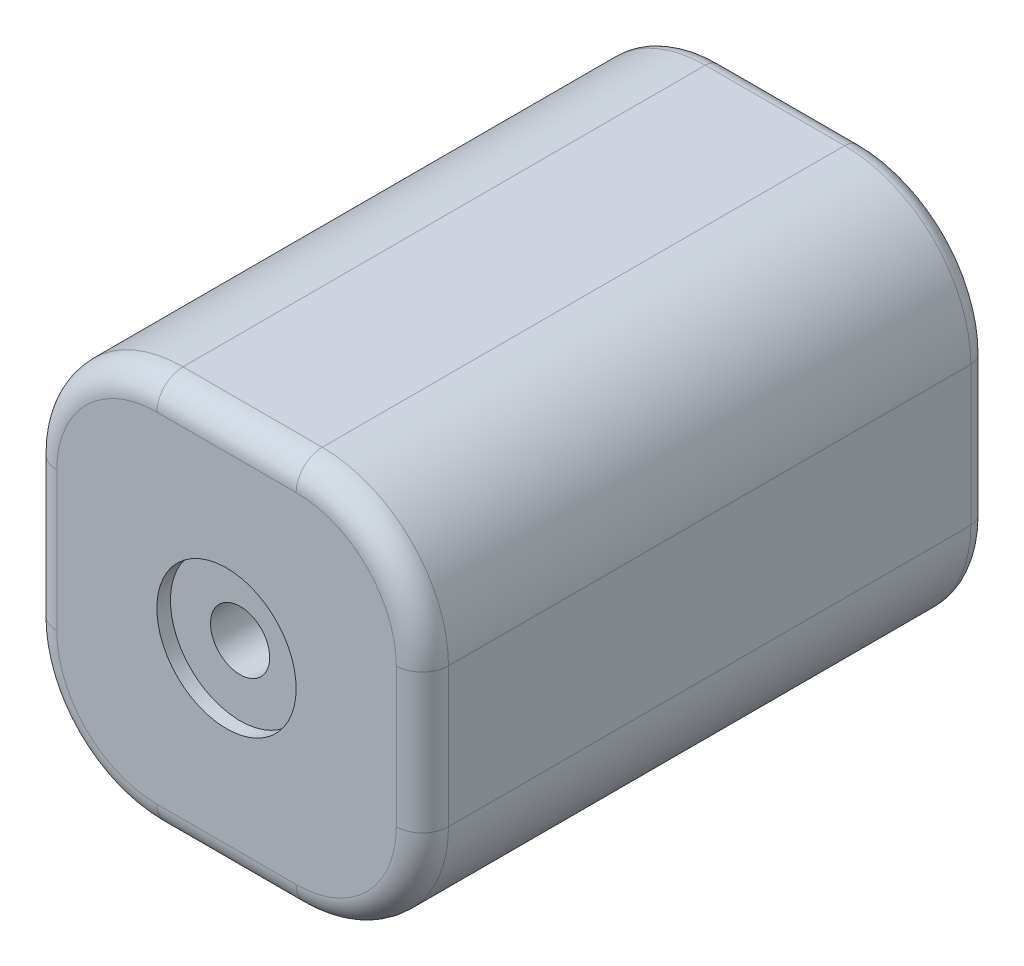
from build123d import *

# Parameters (mm, degrees)
BOSS_EXTRUDE1_DEPTH = 65
FILLET1_R           = 2
BOSS_EXTRUDE2_START = -10
BOSS_EXTRUDE2_DEPTH = 10
SKETCH3_R           = 3.4
CUT_EXTRUDE1_DEPTH  = 73.370574131
FILLET2_R           = 3
SKETCH4_R           = 8
CUT_EXTRUDE2_DEPTH  = 1.56


with BuildPart() as part:
    # Sketch1 → Boss-Extrude1 (new body)
    with BuildSketch(Plane.XY):
        with BuildLine():
            Line((8, 22.5), (-8, 22.5))
            ThreePointArc((-8, 22.5), (-18.253048327, 18.253048327), (-22.5, 8))
            Line((-22.5, 8), (-22.5, -8))
            ThreePointArc((-22.5, -8), (-18.253048327, -18.253048327), (-8, -22.5))
            Line((-8, -22.5), (8, -22.5))
            ThreePointArc((8, -22.5), (18.253048327, -18.253048327), (22.5, -8))
            Line((22.5, -8), (22.5, 8))
            ThreePointArc((22.5, 8), (18.253048327, 18.253048327), (8, 22.5))
        make_face()
        with BuildLine():
            ThreePointArc((-18, 8), (-15.071067812, 15.071067812), (-8, 18))
            Line((-8, 18), (8, 18))
            ThreePointArc((8, 18), (15.071067812, 15.071067812), (18, 8))
            Line((18, 8), (18, -8))
            ThreePointArc((18, -8), (15.071067812, -15.071067812), (8, -18))
            Line((8, -18), (-8, -18))
            ThreePointArc((-8, -18), (-15.071067812, -15.071067812), (-18, -8))
            Line((-18, -8), (-18, 8))
        make_face(mode=Mode.SUBTRACT)
    extrude(amount=BOSS_EXTRUDE1_DEPTH)

    # Fillet1
    fillet1_edges = [part.edges().sort_by_distance(p)[0] for p in [
        (-22.5, 0, 0),
        (-18.253048327, -18.253048327, 0),
        (0, -22.5, 0),
        (18.253048327, -18.253048327, 0),
        (22.5, 0, 0),
        (18.253048327, 18.253048327, 0),
        (0, 22.5, 0),
        (-18.253048327, 18.253048327, 0),
        (15.071067812, -15.071067812, 0),
        (0, -18, 0),
        (-15.071067812, -15.071067812, 0),
        (-18, 0, 0),
        (-15.071067812, 15.071067812, 0),
        (0, 18, 0),
        (15.071067812, 15.071067812, 0),
        (18, 0, 0),
    ]]
    fillet(fillet1_edges, radius=FILLET1_R)

    # Sketch2 → Boss-Extrude2 (add)
    with BuildSketch(Plane.XY.offset(65).offset(BOSS_EXTRUDE2_START)):
        with BuildLine():
            Line((8, -22.5), (-8, -22.5))
            ThreePointArc((-8, -22.5), (-18.253048327, -18.253048327), (-22.5, -8))
            Line((-22.5, -8), (-22.5, 8))
            ThreePointArc((-22.5, 8), (-18.253048327, 18.253048327), (-8, 22.5))
            Line((-8, 22.5), (8, 22.5))
            ThreePointArc((8, 22.5), (18.253048327, 18.253048327), (22.5, 8))
            Line((22.5, 8), (22.5, -8))
            ThreePointArc((22.5, -8), (18.253048327, -18.253048327), (8, -22.5))
        make_face()
    extrude(amount=BOSS_EXTRUDE2_DEPTH)

    # Sketch3 → Cut-Extrude1 (cut, through all)
    with BuildSketch(Plane.XY.offset(65)):
        Circle(SKETCH3_R)
    extrude(amount=-CUT_EXTRUDE1_DEPTH, mode=Mode.SUBTRACT)

    # Fillet2
    fillet2_edges = [part.edges().sort_by_distance(p)[0] for p in [
        (0, 22.5, 65),
        (18.253048327, 18.253048327, 65),
        (22.5, 0, 65),
        (18.253048327, -18.253048327, 65),
        (0, -22.5, 65),
        (-18.253048327, -18.253048327, 65),
        (-22.5, 0, 65),
        (-18.253048327, 18.253048327, 65),
    ]]
    fillet(fillet2_edges, radius=FILLET2_R)

    # Sketch4 → Cut-Extrude2 (cut)
    with BuildSketch(Plane.XY.offset(65)):
        Circle(SKETCH4_R)
    extrude(amount=-CUT_EXTRUDE2_DEPTH, mode=Mode.SUBTRACT)


solid = part.part
